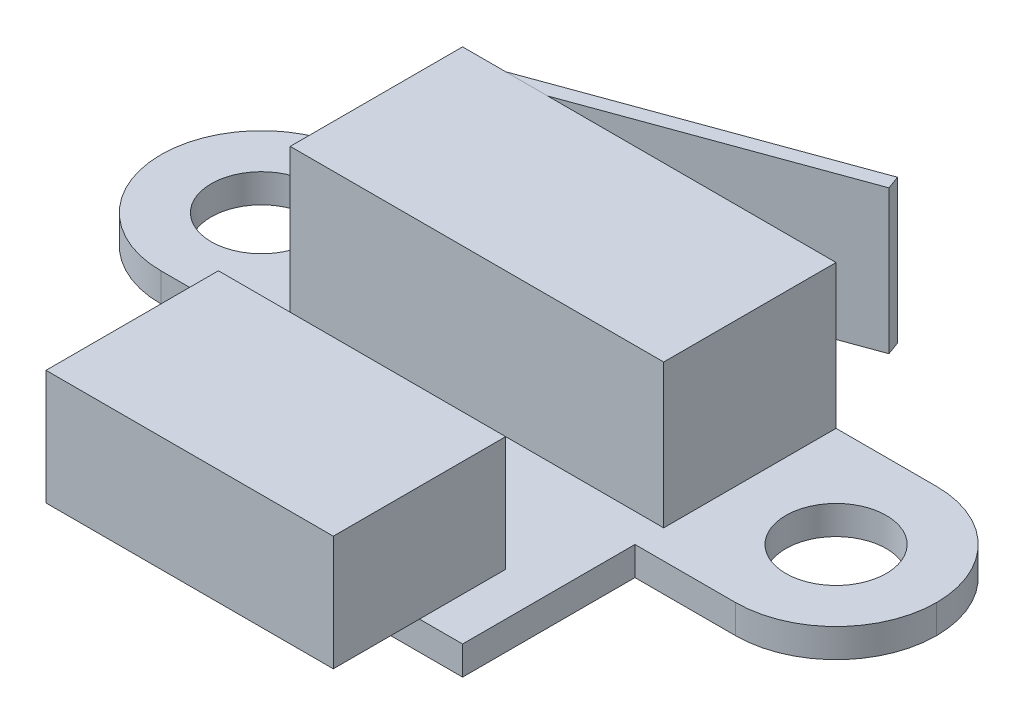
from build123d import *

# Parameters (mm, degrees)
SKETCH1_W           = 13
SKETCH1_H           = 13
BOSS_EXTRUDE1_DEPTH = 1
SKETCH4_W           = 7
SKETCH4_H           = 1
BOSS_EXTRUDE2_DEPTH = 7
SKETCH5_W           = 7
SKETCH5_H           = 1
BOSS_EXTRUDE3_DEPTH = 7
SKETCH6_R           = 1.75
CUT_EXTRUDE1_DEPTH  = 16.016657418
SKETCH7_W           = 10
SKETCH7_H           = 6
BOSS_EXTRUDE4_DEPTH = 4
SKETCH8_W           = 13
SKETCH8_H           = 6
BOSS_EXTRUDE5_DEPTH = 5
BOSS_EXTRUDE7_DEPTH = 5
FILLET1_R           = 3.5


with BuildPart() as part:
    # Sketch1 → Boss-Extrude1 (new body)
    with BuildSketch(Plane(origin=(0, 0, 0), x_dir=(1, 0, 0), z_dir=(0, 1, 0))):
        Rectangle(SKETCH1_W, SKETCH1_H)
    extrude(amount=BOSS_EXTRUDE1_DEPTH)

    # Sketch4 → Boss-Extrude2 (add)
    with BuildSketch(Plane.ZY.offset(6.5)):
        with Locations((-3, 0.5)):
            Rectangle(SKETCH4_W, SKETCH4_H)
    extrude(amount=BOSS_EXTRUDE2_DEPTH)

    # Sketch5 → Boss-Extrude3 (add)
    with BuildSketch(Plane(origin=(6.5, 0, 0), x_dir=(0, 0, -1), z_dir=(1, 0, 0))):
        with Locations((3, 0.5)):
            Rectangle(SKETCH5_W, SKETCH5_H)
    extrude(amount=BOSS_EXTRUDE3_DEPTH)

    # Sketch6 → Cut-Extrude1 (cut, through all)
    with BuildSketch(Plane(origin=(0, 1, 0), x_dir=(1, 0, 0), z_dir=(0, 1, 0))):
        with Locations(Location((-10, 3, 0), (0, 0, 270))):
            Circle(SKETCH6_R)
        with Locations(Location((10, 3, 0), (0, 0, 270))):
            Circle(SKETCH6_R)
    extrude(amount=-CUT_EXTRUDE1_DEPTH, mode=Mode.SUBTRACT)

    # Sketch7 → Boss-Extrude4 (add)
    with BuildSketch(Plane(origin=(0, 1, 0), x_dir=(1, 0, 0), z_dir=(0, 1, 0))):
        with Locations((0, -6.5)):
            Rectangle(SKETCH7_W, SKETCH7_H)
    extrude(amount=BOSS_EXTRUDE4_DEPTH)

    # Sketch8 → Boss-Extrude5 (add)
    with BuildSketch(Plane(origin=(0, 1, 0), x_dir=(1, 0, 0), z_dir=(0, 1, 0))):
        with Locations((0, 3.5)):
            Rectangle(SKETCH8_W, SKETCH8_H)
    extrude(amount=BOSS_EXTRUDE5_DEPTH)

    # Fillet1
    fillet1_edges = [part.edges().sort_by_distance(p)[0] for p in [
        (13.5, 0.5, -6.5),
        (13.5, 0.5, 0.5),
        (-13.5, 0.5, 0.5),
        (-13.5, 0.5, -6.5),
    ]]
    fillet(fillet1_edges, radius=FILLET1_R - 0.0001)  # a hair under: the kernel refuses the full size


with BuildPart() as body_2:
    # Sketch12 → Boss-Extrude7 (new body)
    with BuildSketch(Plane(origin=(0, 6, 0), x_dir=(1, 0, 0), z_dir=(0, 1, 0))):
        Polygon((-5, 6.5), (5, 10.139702343), (5.171010072, 9.669856032), (-3.5380978, 6.5), align=None)
    extrude(amount=-BOSS_EXTRUDE7_DEPTH)


solid = Compound([part.part, body_2.part])
